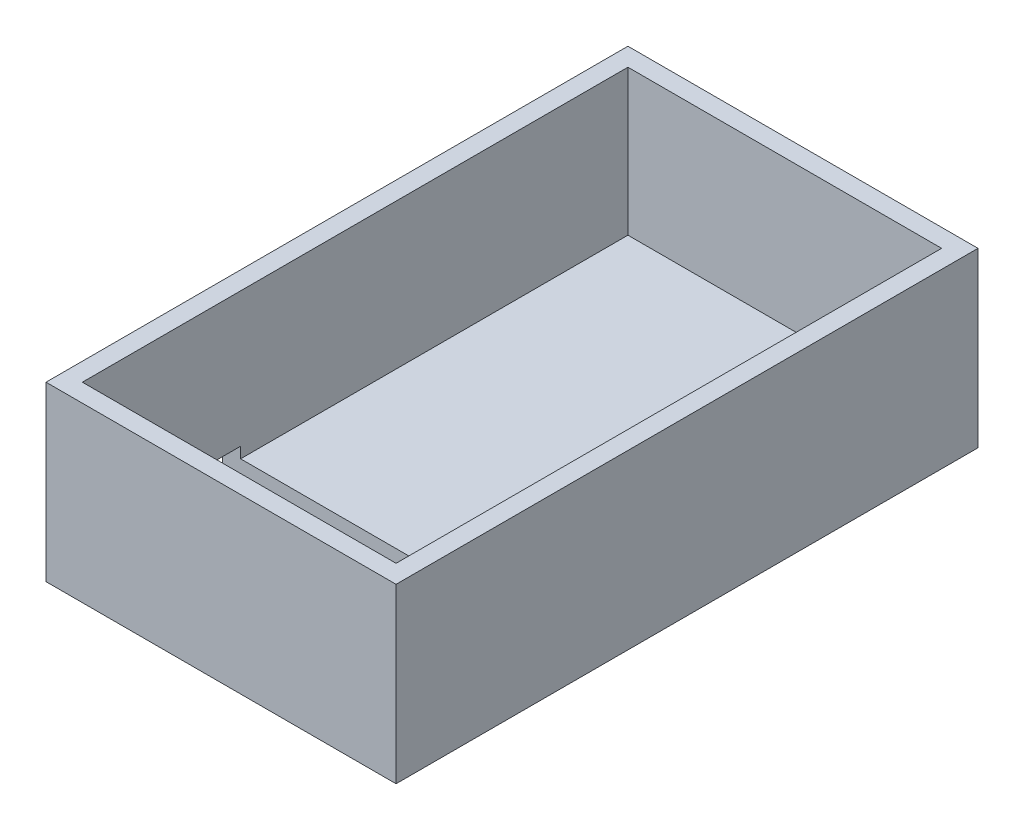
from build123d import *

# Parameters (mm, degrees)
SKETCH1_W           = 34.5
SKETCH1_H           = 60
BOSS_EXTRUDE1_DEPTH = 1
SKETCH2_W           = 38.5
SKETCH2_H           = 64
SKETCH2_W_2         = 34.5
SKETCH2_H_2         = 60
BOSS_EXTRUDE2_DEPTH = 17
SKETCH3_W           = 6
SKETCH3_H           = 3.2
CUT_EXTRUDE1_DEPTH  = 17
BOSS_EXTRUDE3_DEPTH = 2
SKETCH5_W           = 38.5
SKETCH5_H           = 64
SKETCH5_W_2         = 34.5
SKETCH5_H_2         = 60
BOSS_EXTRUDE4_DEPTH = 2
CHAMFER1_SIZE       = 2


with BuildPart() as part:
    # Sketch1 → Boss-Extrude1 (new body)
    with BuildSketch(Plane(origin=(0, 0, 0), x_dir=(1, 0, 0), z_dir=(0, 1, 0))):
        with Locations((17.25, 30)):
            Rectangle(SKETCH1_W, SKETCH1_H)
    extrude(amount=BOSS_EXTRUDE1_DEPTH)

    # Sketch2 → Boss-Extrude2 (add)
    with BuildSketch(Plane.XZ):
        with Locations((17.25, -30)):
            Rectangle(SKETCH2_W, SKETCH2_H)
        with Locations((17.25, -30)):
            Rectangle(SKETCH2_W_2, SKETCH2_H_2, mode=Mode.SUBTRACT)
    extrude(amount=-BOSS_EXTRUDE2_DEPTH)

    # Sketch3 → Cut-Extrude1 (cut)
    with BuildSketch(Plane(origin=(0, 0, 0), x_dir=(0, 0, -1), z_dir=(1, 0, 0))):
        with Locations((14.404129658, 2.6)):
            Rectangle(SKETCH3_W, SKETCH3_H)
    extrude(amount=-CUT_EXTRUDE1_DEPTH, mode=Mode.SUBTRACT)

    # Sketch4 → Boss-Extrude3 (add)
    with BuildSketch(Plane(origin=(0, 1, 0), x_dir=(1, 0, 0), z_dir=(0, 1, 0))):
        Polygon((0, 60), (34.5, 60), (34.5, 0), (0, 0), (0, 11.404129658), (20, 11.404129658), (20, 17.404129658), (0, 17.404129658), align=None)
    extrude(amount=BOSS_EXTRUDE3_DEPTH)

    # Sketch5 → Boss-Extrude4 (add)
    with BuildSketch(Plane(origin=(0, 17, 0), x_dir=(1, 0, 0), z_dir=(0, 1, 0))):
        with Locations((17.25, 30)):
            Rectangle(SKETCH5_W, SKETCH5_H)
        with Locations((17.25, 30)):
            Rectangle(SKETCH5_W_2, SKETCH5_H_2, mode=Mode.SUBTRACT)
    extrude(amount=BOSS_EXTRUDE4_DEPTH)

    # Chamfer1
    chamfer1_edges = [part.edges().sort_by_distance(p)[0] for p in [
        (20, 3, -14.404129658),
    ]]
    chamfer(chamfer1_edges, length=CHAMFER1_SIZE - 0.0001)  # a hair under: the kernel refuses the full size


solid = part.part
